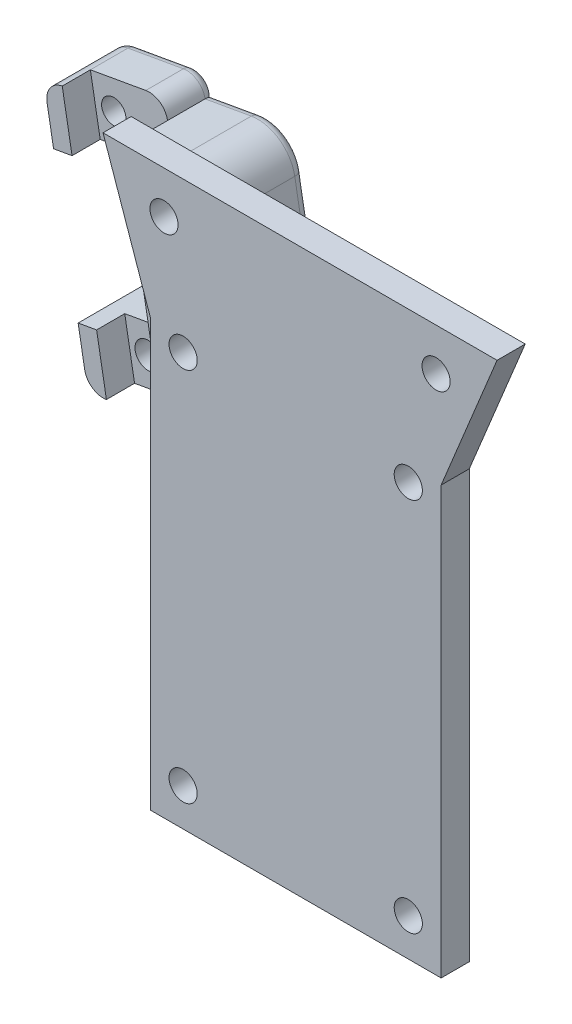
from build123d import *

# Parameters (mm, degrees)
SKETCH1_R           = 1.5
BOSS_EXTRUDE1_DEPTH = 3
SKETCH3_R           = 2.6
SKETCH3_R_2         = 1.5
BOSS_EXTRUDE2_DEPTH = 5
SKETCH6_R           = 2.6
BOSS_EXTRUDE5_DEPTH = 3
CUT_EXTRUDE1_DEPTH  = 3
SKETCH4_W           = 8
SKETCH4_H           = 27
BOSS_EXTRUDE7_DEPTH = 2
SKETCH9_W           = 5
SKETCH9_H           = 6
BOSS_EXTRUDE8_DEPTH = 8
SKETCH10_W          = 3
SKETCH10_H          = 5
CUT_EXTRUDE2_DEPTH  = 2
SKETCH11_R          = 1.4
SKETCH11_R_2        = 1.3
CUT_EXTRUDE3_DEPTH  = 5
BOSS_EXTRUDE9_DEPTH = 3
FILLET1_R           = 2
FILLET2_R           = 1


with BuildPart() as part:
    # Sketch1 → Boss-Extrude1 (new body)
    with BuildSketch(Plane.XY):
        Polygon((0, 0), (31, 0), (31, 45.5), (36.963007518, 60), (-5.036992482, 60), (0, 45.5), align=None)
        with Locations((30.463007518, 55.5)):
            Circle(SKETCH1_R, mode=Mode.SUBTRACT)
        with Locations((27.5, 44)):
            Circle(SKETCH1_R, mode=Mode.SUBTRACT)
        with Locations((27.5, 4)):
            Circle(SKETCH1_R, mode=Mode.SUBTRACT)
        with Locations((3.5, 4)):
            Circle(SKETCH1_R, mode=Mode.SUBTRACT)
        with Locations((3.5, 44)):
            Circle(SKETCH1_R, mode=Mode.SUBTRACT)
        with Locations((1.463007518, 55.5)):
            Circle(SKETCH1_R, mode=Mode.SUBTRACT)
    extrude(amount=BOSS_EXTRUDE1_DEPTH)


with BuildPart() as body_2:
    # Sketch3 → Boss-Extrude2 (new body)
    with BuildSketch(Plane(origin=(0, 0, 0), x_dir=(-1, 0, 0), z_dir=(0, 0, -1))):
        with BuildLine():
            Line((-5.401696606, 56.197659136), (-7.438689088, 44.697659136))
            ThreePointArc((-7.438689088, 44.697659136), (-6.778393269, 41.708245743), (-4.197659136, 40.061310912))
            Line((-4.197659136, 40.061310912), (0.725702224, 39.189236993))
            Line((0.725702224, 39.189236993), (4.158012977, 58.566615168))
            Line((4.158012977, 58.566615168), (-0.765348382, 59.438689088))
            ThreePointArc((-0.765348382, 59.438689088), (-3.754761775, 58.778393269), (-5.401696606, 56.197659136))
        make_face()
        with Locations((-1.463007518, 55.5)):
            Circle(SKETCH3_R, mode=Mode.SUBTRACT)
        with Locations((-3.5, 44)):
            Circle(SKETCH3_R_2, mode=Mode.SUBTRACT)
    extrude(amount=BOSS_EXTRUDE2_DEPTH)

    # Sketch6 → Boss-Extrude5 (add)
    with BuildSketch(Plane(origin=(0, 0, -5), x_dir=(-1, 0, 0), z_dir=(0, 0, -1))):
        with BuildLine():
            Line((-6.420192847, 50.447659136), (2.441857601, 48.87792608))
            Line((2.441857601, 48.87792608), (4.158012977, 58.566615168))
            Line((4.158012977, 58.566615168), (-0.765348382, 59.438689088))
            ThreePointArc((-0.765348382, 59.438689088), (-3.754761775, 58.778393269), (-5.401696606, 56.197659136))
            Line((-5.401696606, 56.197659136), (-6.420192847, 50.447659136))
        make_face()
        with Locations((-1.463007518, 55.5)):
            Circle(SKETCH6_R, mode=Mode.SUBTRACT)
    extrude(amount=BOSS_EXTRUDE5_DEPTH)

    # Sketch8 → Cut-Extrude1 (cut)
    with BuildSketch(Plane(origin=(0, 0, -5), x_dir=(-1, 0, 0), z_dir=(0, 0, -1))):
        Polygon((-3.5, 40.75), (-0.685417438, 42.375), (-0.685417438, 45.625), (-3.5, 47.25), (-6.314582562, 45.625), (-6.314582562, 42.375), align=None)
    extrude(amount=-CUT_EXTRUDE1_DEPTH, mode=Mode.SUBTRACT)

    # Sketch4 → Boss-Extrude7 (add)
    with BuildSketch(Plane(origin=(6.026788499, 1.067523727, 0), x_dir=(0, 0, 1), z_dir=(-0.9846722719514623, -0.17441478392024493, 0))):
        with Locations((-4, 46.894140953)):
            Rectangle(SKETCH4_W, SKETCH4_H)
    extrude(amount=BOSS_EXTRUDE7_DEPTH)

    # Sketch9 → Boss-Extrude8 (add)
    with BuildSketch(Plane(origin=(4.057443955, 0.718694159, 0), x_dir=(0, 0, 1), z_dir=(-0.9846722719514623, -0.17441478392024487, 0))):
        with Locations((-5.5, 57.394140953)):
            Rectangle(SKETCH9_W, SKETCH9_H)
        with Locations((-5.5, 36.394140953)):
            Rectangle(SKETCH9_W, SKETCH9_H)
    extrude(amount=BOSS_EXTRUDE8_DEPTH)

    # Sketch10 → Cut-Extrude2 (cut)
    with BuildSketch(Plane(origin=(4.057443955, 0.718694159, 0), x_dir=(0, 0, 1), z_dir=(-0.9846722719514623, -0.17441478392024487, 0))):
        with Locations((-1.5, 57.894140953)):
            Rectangle(SKETCH10_W, SKETCH10_H)
        with Locations((-1.5, 35.894140953)):
            Rectangle(SKETCH10_W, SKETCH10_H)
    extrude(amount=-CUT_EXTRUDE2_DEPTH, mode=Mode.SUBTRACT)

    # Sketch11 → Cut-Extrude3 (cut)
    with BuildSketch(Plane.XY.offset(-3)):
        with Locations((-6.228921363, 35.857336482)):
            Circle(SKETCH11_R)
        with Locations((-9.891631825, 56.535454193)):
            Circle(SKETCH11_R_2)
    extrude(amount=-CUT_EXTRUDE3_DEPTH, mode=Mode.SUBTRACT)

    # Sketch12 → Boss-Extrude9 (add)
    with BuildSketch(Plane.XY.offset(-3)):
        Polygon((-10.690854802, 38.113694162), (-9.644366099, 32.20566053), (-7.675021555, 32.554490098), (-8.721510258, 38.46252373), align=None)
        Polygon((-14.353565265, 58.791811873), (-13.307076561, 52.883778241), (-11.337732017, 53.232607809), (-12.384220721, 59.140641441), align=None)
    extrude(amount=BOSS_EXTRUDE9_DEPTH)

    # Fillet1
    # the kernel refuses this fillet: 2 mm, written as the material it adds along each edge
    with BuildSketch(Plane(origin=(-0.725702224, 39.189236993, -5), x_dir=(0.9846722719514622, 0.1744147839202449, 0), z_dir=(-0.1744147839202449, 0.9846722719514622, 0))) as fillet1_piece_1_section:
        with BuildLine():
            CenterArc((FILLET1_R, FILLET1_R), FILLET1_R, 180, 90)
            Line((0, FILLET1_R), (0, 0))
            Line((0, 0), (FILLET1_R, 0))
        make_face()
    fillet1_piece_1 = extrude(amount=14.839506366, mode=Mode.PRIVATE)
    fillet1_piece_1 = split(fillet1_piece_1, bisect_by=Plane(origin=(1.750934761, 41.759823287, -5.016294478), z_dir=(-0.49999999999999994, -0.8660254037844387, 0)), keep=Keep.TOP, mode=Mode.PRIVATE)
    add(fillet1_piece_1)
    with BuildSketch(Plane(origin=(-0.725702224, 39.189236993, -5), x_dir=(0.9846722719514622, 0.1744147839202449, 0), z_dir=(-0.1744147839202449, 0.9846722719514622, 0))) as fillet1_piece_2_section:
        with BuildLine():
            CenterArc((FILLET1_R, FILLET1_R), FILLET1_R, 180, 90)
            Line((0, FILLET1_R), (0, 0))
            Line((0, 0), (FILLET1_R, 0))
        make_face()
    fillet1_piece_2 = extrude(amount=14.839506366, mode=Mode.PRIVATE)
    fillet1_piece_2 = split(fillet1_piece_2, bisect_by=Plane(origin=(0.685417438, 46.149775088, -5.43451479), z_dir=(-1, 0, 0)), keep=Keep.TOP, mode=Mode.PRIVATE)
    add(fillet1_piece_2)
    with BuildSketch(Plane(origin=(6.420192847, 50.447659136, -5), x_dir=(0.1744147839202439, -0.9846722719514623, 0), z_dir=(-0.9846722719514623, -0.17441478392024387, 0))) as fillet1_piece_3:
        with BuildLine():
            CenterArc((FILLET1_R, -FILLET1_R), FILLET1_R, 90, 90)
            Line((0, -FILLET1_R), (0, 0))
            Line((0, 0), (FILLET1_R, 0))
        make_face()
    extrude(amount=9)
    # the kernel refuses this fillet: 2 mm, written as the material it takes off along each edge
    with BuildSketch(Plane(origin=(-4.506842545, 60.535959712, -13), x_dir=(0.17441478392024556, -0.9846722719514621, 0), z_dir=(0, 0, 1))) as fillet1_2_piece_1:
        with BuildLine():
            CenterArc((FILLET1_R, -FILLET1_R), FILLET1_R, 90, 90)
            Line((0, -FILLET1_R), (0, 0))
            Line((0, 0), (FILLET1_R, 0))
        make_face()
    extrude(amount=15, mode=Mode.SUBTRACT)
    with BuildSketch(Plane(origin=(0.202356621, 33.949808369, 2), x_dir=(-0.9846722719514622, -0.17441478392024462, 0), z_dir=(0, 0, -1))) as fillet1_2_piece_2:
        with BuildLine():
            CenterArc((FILLET1_R, FILLET1_R), FILLET1_R, 180, 90)
            Line((0, FILLET1_R), (0, 0))
            Line((0, 0), (FILLET1_R, 0))
        make_face()
    extrude(amount=15, mode=Mode.SUBTRACT)
    with BuildSketch(Plane(origin=(-14.353565265, 58.791811873, -13), x_dir=(0.9846722719514622, 0.17441478392024498, 0), z_dir=(0, 0, 1))) as fillet1_2_piece_3:
        with BuildLine():
            CenterArc((FILLET1_R, -FILLET1_R), FILLET1_R, 90, 90)
            Line((0, -FILLET1_R), (0, 0))
            Line((0, 0), (FILLET1_R, 0))
        make_face()
    extrude(amount=18, mode=Mode.SUBTRACT)
    with BuildSketch(Plane(origin=(-9.644366099, 32.20566053, 5), x_dir=(-0.1744147839202448, 0.9846722719514623, 0), z_dir=(0, 0, -1))) as fillet1_2_piece_4:
        with BuildLine():
            CenterArc((FILLET1_R, FILLET1_R), FILLET1_R, 180, 90)
            Line((0, FILLET1_R), (0, 0))
            Line((0, 0), (FILLET1_R, 0))
        make_face()
    extrude(amount=18, mode=Mode.SUBTRACT)

    # Fillet2
    # the kernel refuses this fillet: 1 mm, written as the material it takes off along each edge
    with BuildSketch(Plane(origin=(1.463007518, 55.5, -8), x_dir=(-0.17441478392024487, 0.9846722719514622, 0), z_dir=(-0.9846722719514622, -0.17441478392024487, 0))) as fillet2_piece_1:
        with BuildLine():
            CenterArc((4 - FILLET2_R, -FILLET2_R), FILLET2_R, 0, 90)
            Line((4, -FILLET2_R), (4, 0))
            Line((4, 0), (4 - FILLET2_R, 0))
        make_face()
    revolve(axis=Axis((1.463007518, 55.5, -8), (0, 0, -1)), revolution_arc=90, mode=Mode.SUBTRACT)
    with BuildSketch(Plane(origin=(-6.619693657, 58.130578208, -8), x_dir=(0.17441478392024404, -0.9846722719514623, 0), z_dir=(0.9846722719514623, 0.17441478392024404, 0))) as fillet2_piece_2_section:
        with BuildLine():
            CenterArc((FILLET2_R, -FILLET2_R), FILLET2_R, 90, 90)
            Line((0, -FILLET2_R), (0, 0))
            Line((0, 0), (FILLET2_R, 0))
        make_face()
    fillet2_piece_2 = extrude(amount=7.5, mode=Mode.PRIVATE)
    fillet2_piece_2 = fillet2_piece_2 - Plane(origin=(-6.127357521, 58.2177856, -7.77443348), x_dir=(0.17441478392008683, -0.9846722719514902, 0), z_dir=(0, 0, -1)) * Cylinder(2, 19, mode=Mode.PRIVATE)
    add(fillet2_piece_2, mode=Mode.SUBTRACT)
    with BuildSketch(Plane(origin=(-0.146472947, 35.919152913, -8), x_dir=(-0.9846722719514621, -0.1744147839202449, 0), z_dir=(-0.1744147839202449, 0.9846722719514621, 0))) as fillet2_piece_3:
        with BuildLine():
            CenterArc((FILLET2_R, FILLET2_R), FILLET2_R, 180, 90)
            Line((0, FILLET2_R), (0, 0))
            Line((0, 0), (FILLET2_R, 0))
        make_face()
    extrude(amount=13.160493634, mode=Mode.SUBTRACT)
    with BuildSketch(Plane(origin=(-6.476187089, 60.187130144, -8), x_dir=(0.1744147839202434, -0.9846722719514625, 0), z_dir=(-0.9846722719514625, -0.1744147839202434, 0)), Plane(origin=(-7.675021555, 32.554490098, -8), x_dir=(-0.1744147839202434, 0.9846722719514625, 0), z_dir=(0.9846722719514625, 0.1744147839202434, 0))) as fillet2_piece_4:
        with BuildLine():
            CenterArc((FILLET2_R, FILLET2_R), FILLET2_R, 180, 90)
            Line((0, FILLET2_R), (0, 0))
            Line((0, 0), (FILLET2_R, 0))
        make_face()
    extrude(amount=6, mode=Mode.SUBTRACT)
    with BuildSketch(Plane(origin=(-2.813476627, 39.509012433, -8), x_dir=(0.9846722719514622, 0.17441478392024493, 0), z_dir=(-0.1744147839202449, 0.9846722719514621, 0))) as fillet2_piece_5:
        with BuildLine():
            CenterArc((FILLET2_R, -FILLET2_R), FILLET2_R, 90, 90)
            Line((0, -FILLET2_R), (0, 0))
            Line((0, 0), (FILLET2_R, 0))
        make_face()
    extrude(amount=15, mode=Mode.SUBTRACT)
    with BuildSketch(Plane(origin=(-12.871039601, 50.422097561, -8), x_dir=(0.9846722719514622, 0.17441478392024487, 0), z_dir=(-0.17441478392024487, 0.9846722719514623, 0))) as fillet2_piece_6:
        with BuildLine():
            CenterArc((FILLET2_R, -FILLET2_R), FILLET2_R, 90, 90)
            Line((0, -FILLET2_R), (0, 0))
            Line((0, 0), (FILLET2_R, 0))
        make_face()
    extrude(amount=6.5, mode=Mode.SUBTRACT)
    with BuildSketch(Plane(origin=(-5.429698386, 54.279096513, -8), x_dir=(-0.17441478392024484, 0.9846722719514622, 0), z_dir=(-0.9846722719514623, -0.17441478392024487, 0))) as fillet2_piece_7:
        with BuildLine():
            CenterArc((FILLET2_R, -FILLET2_R), FILLET2_R, 90, 90)
            Line((0, -FILLET2_R), (0, 0))
            Line((0, 0), (FILLET2_R, 0))
        make_face()
    extrude(amount=10.5, mode=Mode.SUBTRACT)
    with BuildSketch(Plane(origin=(-2.813476627, 39.509012433, -8), x_dir=(0.17441478392024484, -0.9846722719514622, 0), z_dir=(-0.9846722719514623, -0.17441478392024487, 0))) as fillet2_piece_8:
        with BuildLine():
            CenterArc((FILLET2_R, FILLET2_R), FILLET2_R, 180, 90)
            Line((0, FILLET2_R), (0, 0))
            Line((0, 0), (FILLET2_R, 0))
        make_face()
    extrude(amount=10.5, mode=Mode.SUBTRACT)
    with BuildSketch(Plane(origin=(-11.126891762, 40.575374842, -8), x_dir=(0.9846722719514622, 0.17441478392024487, 0), z_dir=(0.17441478392024487, -0.9846722719514623, 0))) as fillet2_piece_9:
        with BuildLine():
            CenterArc((FILLET2_R, FILLET2_R), FILLET2_R, 180, 90)
            Line((0, FILLET2_R), (0, 0))
            Line((0, 0), (FILLET2_R, 0))
        make_face()
    extrude(amount=6.5, mode=Mode.SUBTRACT)
    with BuildSketch(Plane(origin=(8.881873527, 50.883696095, -8), x_dir=(0, 0, 1), z_dir=(-0.9846722719514623, -0.17441478392024387, 0))) as fillet2_piece_10:
        with BuildLine():
            CenterArc((FILLET2_R, FILLET2_R), FILLET2_R, 180, 90)
            Line((0, FILLET2_R), (0, 0))
            Line((0, 0), (FILLET2_R, 0))
        make_face()
    extrude(amount=11.5, mode=Mode.SUBTRACT)
    with BuildSketch(Plane(origin=(5.401696606, 56.197659136, -8), x_dir=(1.0801180343414839e-12, 1.913210709129383e-13, 1.0), z_dir=(0.1744147839202451, -0.9846722719514622, 0))) as fillet2_piece_11:
        with BuildLine():
            CenterArc((FILLET2_R, FILLET2_R), FILLET2_R, 180, 90)
            Line((0, FILLET2_R), (0, 0))
            Line((0, 0), (FILLET2_R, 0))
        make_face()
    extrude(amount=8.339506366, mode=Mode.SUBTRACT)
    with BuildSketch(Plane(origin=(-12.035391153, 57.171296897, -8), x_dir=(-0.9846722719514899, -0.17441478392008852, 0), z_dir=(0.17441478392008852, -0.9846722719514899, 0))) as fillet2_piece_12:
        with BuildLine():
            CenterArc((2 - FILLET2_R, -FILLET2_R), FILLET2_R, 0, 90)
            Line((2, -FILLET2_R), (2, 0))
            Line((2, 0), (2 - FILLET2_R, 0))
        make_face()
    revolve(axis=Axis((-12.035391153, 57.171296897, -8), (0, 0, -1)), revolution_arc=90, mode=Mode.SUBTRACT)
    with BuildSketch(Plane(origin=(-8.023851123, 34.523834642, -8), x_dir=(-0.98467227195149, -0.17441478392008838, 0), z_dir=(-0.17441478392008838, 0.98467227195149, 0))) as fillet2_piece_13:
        with BuildLine():
            CenterArc((2 - FILLET2_R, FILLET2_R), FILLET2_R, 270, 90)
            Line((2, FILLET2_R), (2, 0))
            Line((2, 0), (2 - FILLET2_R, 0))
        make_face()
    revolve(axis=Axis((-8.023851123, 34.523834642, -8), (0, 0, 1)), revolution_arc=90, mode=Mode.SUBTRACT)
    with BuildSketch(Plane(origin=(-2.115817491, 35.570323345, -8), x_dir=(0.1744147839200875, -0.9846722719514901, 0), z_dir=(-0.9846722719514901, -0.1744147839200875, 0))) as fillet2_piece_14:
        with BuildLine():
            CenterArc((2 - FILLET2_R, FILLET2_R), FILLET2_R, 270, 90)
            Line((2, FILLET2_R), (2, 0))
            Line((2, 0), (2 - FILLET2_R, 0))
        make_face()
    revolve(axis=Axis((-2.115817491, 35.570323345, -8), (0, 0, 1)), revolution_arc=90, mode=Mode.SUBTRACT)
    with BuildSketch(Plane(origin=(-6.127357521, 58.2177856, -8), x_dir=(-0.17441478392008739, 0.9846722719514901, 0), z_dir=(-0.9846722719514901, -0.17441478392008739, 0))) as fillet2_piece_15:
        with BuildLine():
            CenterArc((2 - FILLET2_R, -FILLET2_R), FILLET2_R, 0, 90)
            Line((2, -FILLET2_R), (2, 0))
            Line((2, 0), (2 - FILLET2_R, 0))
        make_face()
    revolve(axis=Axis((-6.127357521, 58.2177856, -8), (0, 0, -1)), revolution_arc=90, mode=Mode.SUBTRACT)
    with BuildSketch(Plane(origin=(1.463007518, 55.5, -8), x_dir=(-1, 0, 0), z_dir=(0, -1, 0))) as fillet2_piece_16:
        with BuildLine():
            CenterArc((2.6 + FILLET2_R, -FILLET2_R), FILLET2_R, 90, 90)
            Line((2.6, -FILLET2_R), (2.6, 0))
            Line((2.6, 0), (2.6 + FILLET2_R, 0))
        make_face()
    revolve(axis=Axis((1.463007518, 55.5, -8), (0, 0, -1)), mode=Mode.SUBTRACT)
    with BuildSketch(Plane(origin=(-9.891631825, 56.535454193, -8), x_dir=(1, 0, 0), z_dir=(0, -1, 0))) as fillet2_piece_17:
        with BuildLine():
            CenterArc((1.3 + FILLET2_R, FILLET2_R), FILLET2_R, 180, 90)
            Line((1.3, FILLET2_R), (1.3, 0))
            Line((1.3, 0), (1.3 + FILLET2_R, 0))
        make_face()
    revolve(axis=Axis((-9.891631825, 56.535454193, -8), (0, 0, 1)), mode=Mode.SUBTRACT)
    with BuildSketch(Plane(origin=(-6.228921363, 35.857336482, -8), x_dir=(1, 0, 0), z_dir=(0, -1, 0))) as fillet2_piece_18:
        with BuildLine():
            CenterArc((1.4 + FILLET2_R, FILLET2_R), FILLET2_R, 180, 90)
            Line((1.4, FILLET2_R), (1.4, 0))
            Line((1.4, 0), (1.4 + FILLET2_R, 0))
        make_face()
    revolve(axis=Axis((-6.228921363, 35.857336482, -8), (0, 0, 1)), mode=Mode.SUBTRACT)
    with BuildSketch(Plane(origin=(-6.619693657, 58.130578208, -8), x_dir=(0.17441478392024404, -0.9846722719514623, 0), z_dir=(0.9846722719514623, 0.17441478392024404, 0))) as fillet2_piece_19a_section:
        with BuildLine():
            CenterArc((FILLET2_R, -FILLET2_R), FILLET2_R, 90, 90)
            Line((0, -FILLET2_R), (0, 0))
            Line((0, 0), (FILLET2_R, 0))
        make_face()
    fillet2_piece_19a = extrude(amount=7.5, mode=Mode.PRIVATE)
    fillet2_piece_19a = fillet2_piece_19a & Plane(origin=(-6.127357521, 58.2177856, -7.771922902), x_dir=(0.17441478392008683, -0.9846722719514902, 0), z_dir=(0, 0, -1)) * Cylinder(2, 19, mode=Mode.PRIVATE)
    with BuildSketch(Plane(origin=(-6.127357521, 58.2177856, -8), x_dir=(-0.17441478392008739, 0.9846722719514901, 0), z_dir=(-0.9846722719514901, -0.17441478392008739, 0))) as fillet2_piece_19b_section:
        with BuildLine():
            CenterArc((2 - FILLET2_R, -FILLET2_R), FILLET2_R, 0, 90)
            Line((2, -FILLET2_R), (2, 0))
            Line((2, 0), (2 - FILLET2_R, 0))
        make_face()
    fillet2_piece_19b = revolve(axis=Axis((-6.127357521, 58.2177856, -8), (0, 0, -1)), revolution_arc=161.648494619, mode=Mode.PRIVATE)
    fillet2_piece_19b = split(fillet2_piece_19b, bisect_by=Plane(origin=(-4.782224034, 58.4560488, -7.758124149), z_dir=(0.1744147839202442, -0.9846722719514623, 0)), keep=Keep.TOP, mode=Mode.PRIVATE)
    fillet2_piece_19 = fillet2_piece_19a & fillet2_piece_19b
    add(fillet2_piece_19, mode=Mode.SUBTRACT)
    with BuildSketch(Plane(origin=(8.881873527, 50.883696095, -8), x_dir=(0, 0, 1), z_dir=(-0.9846722719514623, -0.17441478392024387, 0))) as fillet2_piece_20a_section:
        with BuildLine():
            CenterArc((FILLET2_R, FILLET2_R), FILLET2_R, 180, 90)
            Line((0, FILLET2_R), (0, 0))
            Line((0, 0), (FILLET2_R, 0))
        make_face()
    fillet2_piece_20a = extrude(amount=14, mode=Mode.PRIVATE)
    fillet2_piece_20a = split(fillet2_piece_20a, bisect_by=Plane(origin=(-2.481344256, 49.100851072, -7.773604886), z_dir=(-0.9846722719514623, -0.17441478392024493, 0)), keep=Keep.TOP, mode=Mode.PRIVATE)
    with BuildSketch(Plane(origin=(-0.146472947, 35.919152913, -8), x_dir=(-0.9846722719514621, -0.1744147839202449, 0), z_dir=(-0.1744147839202449, 0.9846722719514621, 0))) as fillet2_piece_20b_section:
        with BuildLine():
            CenterArc((FILLET2_R, FILLET2_R), FILLET2_R, 180, 90)
            Line((0, FILLET2_R), (0, 0))
            Line((0, 0), (FILLET2_R, 0))
        make_face()
    fillet2_piece_20b = extrude(amount=15.660493634, mode=Mode.PRIVATE)
    fillet2_piece_20b = split(fillet2_piece_20b, bisect_by=Plane(origin=(-2.664782592, 48.838439425, -7.773604886), z_dir=(-0.17441478392024387, 0.9846722719514623, 0)), keep=Keep.TOP, mode=Mode.PRIVATE)
    fillet2_piece_20 = fillet2_piece_20a & fillet2_piece_20b
    add(fillet2_piece_20, mode=Mode.SUBTRACT)
    with BuildSketch(Plane(origin=(-2.377439667, 37.047331753, -8), x_dir=(0.9846722719514622, 0.17441478392024493, 0), z_dir=(-0.1744147839202449, 0.9846722719514621, 0))) as fillet2_piece_21a_section:
        with BuildLine():
            CenterArc((FILLET2_R, -FILLET2_R), FILLET2_R, 90, 90)
            Line((0, -FILLET2_R), (0, 0))
            Line((0, 0), (FILLET2_R, 0))
        make_face()
    fillet2_piece_21a = extrude(amount=17.5, mode=Mode.PRIVATE)
    fillet2_piece_21a = split(fillet2_piece_21a, bisect_by=Plane(origin=(-2.590551635, 39.548499088, -7.773604886), z_dir=(0.17441478392024487, -0.9846722719514623, 0)), keep=Keep.TOP, mode=Mode.PRIVATE)
    with BuildSketch(Plane(origin=(-0.351795947, 39.945049393, -8), x_dir=(0.17441478392024484, -0.9846722719514622, 0), z_dir=(-0.9846722719514623, -0.17441478392024487, 0))) as fillet2_piece_21b_section:
        with BuildLine():
            CenterArc((FILLET2_R, FILLET2_R), FILLET2_R, 180, 90)
            Line((0, FILLET2_R), (0, 0))
            Line((0, 0), (FILLET2_R, 0))
        make_face()
    fillet2_piece_21b = extrude(amount=13, mode=Mode.PRIVATE)
    fillet2_piece_21b = split(fillet2_piece_21b, bisect_by=Plane(origin=(-2.773989972, 39.286087442, -7.773604886), z_dir=(0.9846722719514623, 0.17441478392024493, 0)), keep=Keep.TOP, mode=Mode.PRIVATE)
    fillet2_piece_21 = fillet2_piece_21a & fillet2_piece_21b
    add(fillet2_piece_21, mode=Mode.SUBTRACT)
    with BuildSketch(Plane(origin=(-2.968017706, 54.715133472, -8), x_dir=(-0.17441478392024484, 0.9846722719514622, 0), z_dir=(-0.9846722719514623, -0.17441478392024487, 0))) as fillet2_piece_22a_section:
        with BuildLine():
            CenterArc((FILLET2_R, -FILLET2_R), FILLET2_R, 90, 90)
            Line((0, -FILLET2_R), (0, 0))
            Line((0, 0), (FILLET2_R, 0))
        make_face()
    fillet2_piece_22a = extrude(amount=13, mode=Mode.PRIVATE)
    fillet2_piece_22a = split(fillet2_piece_22a, bisect_by=Plane(origin=(-5.46918504, 54.502021504, -7.773604886), z_dir=(0.9846722719514623, 0.17441478392024493, 0)), keep=Keep.TOP, mode=Mode.PRIVATE)
    with BuildSketch(Plane(origin=(-2.813476627, 39.509012433, -8), x_dir=(0.9846722719514622, 0.17441478392024493, 0), z_dir=(-0.1744147839202449, 0.9846722719514621, 0))) as fillet2_piece_22b_section:
        with BuildLine():
            CenterArc((FILLET2_R, -FILLET2_R), FILLET2_R, 90, 90)
            Line((0, -FILLET2_R), (0, 0))
            Line((0, 0), (FILLET2_R, 0))
        make_face()
    fillet2_piece_22b = extrude(amount=17.5, mode=Mode.PRIVATE)
    fillet2_piece_22b = split(fillet2_piece_22b, bisect_by=Plane(origin=(-5.206773394, 54.318583167, -7.773604886), z_dir=(-0.17441478392024487, 0.9846722719514623, 0)), keep=Keep.TOP, mode=Mode.PRIVATE)
    fillet2_piece_22 = fillet2_piece_22a & fillet2_piece_22b
    add(fillet2_piece_22, mode=Mode.SUBTRACT)


solid = Compound([part.part, body_2.part])
